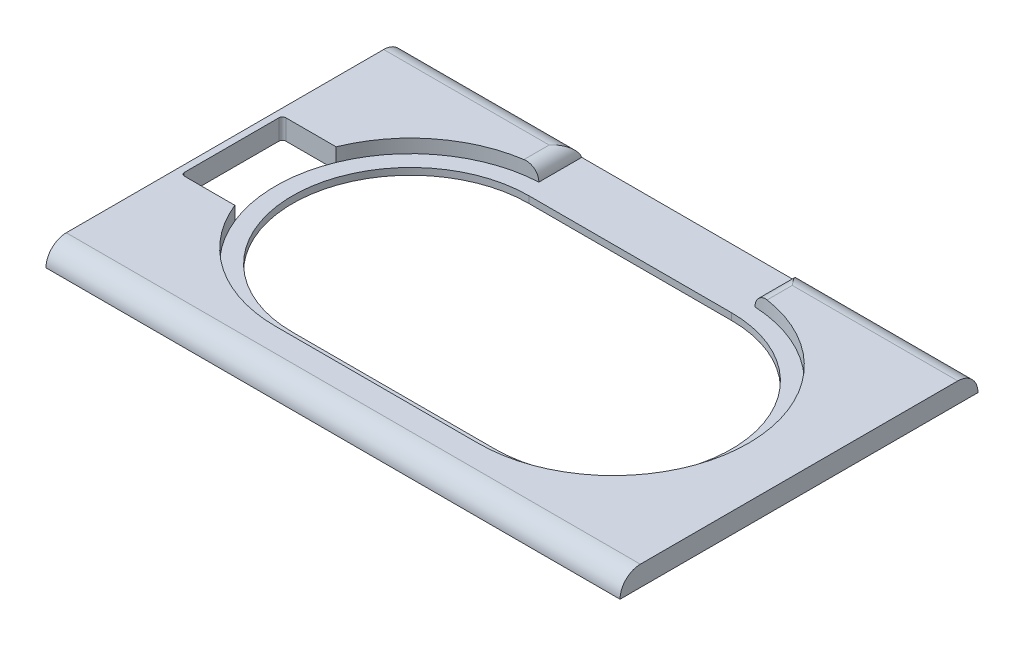
from build123d import *

# Parameters (mm, degrees)
SKETCH1_W           = 170
SKETCH1_H           = 106
BOSS_EXTRUDE1_DEPTH = 6
FILLET1_R           = 6
CUT_EXTRUDE1_DEPTH  = 4
CUT_EXTRUDE2_DEPTH  = 201.429538741
CUT_EXTRUDE3_DEPTH  = 25
CUT_EXTRUDE4_DEPTH  = 201.379639771
FILLET2_R           = 1


with BuildPart() as part:
    # Sketch1 → Boss-Extrude1 (new body)
    with BuildSketch(Plane(origin=(0, 0, 0), x_dir=(1, 0, 0), z_dir=(0, 1, 0))):
        with Locations((85, -53)):
            Rectangle(SKETCH1_W, SKETCH1_H)
    extrude(amount=BOSS_EXTRUDE1_DEPTH)

    # Fillet1
    fillet1_edges = [part.edges().sort_by_distance(p)[0] for p in [
        (85, 6, 106),
        (85, 6, 0),
    ]]
    fillet(fillet1_edges, radius=FILLET1_R - 0.0001)  # a hair under: the kernel refuses the full size

    # Sketch2 → Cut-Extrude1 (cut)
    with BuildSketch(Plane(origin=(0, 6, 0), x_dir=(1, 0, 0), z_dir=(0, 1, 0))):
        with BuildLine():
            Line((55, -13), (115, -13))
            ThreePointArc((115, -13), (155, -53), (115, -93))
            Line((115, -93), (55, -93))
            ThreePointArc((55, -93), (15, -53), (55, -13))
        make_face()
    extrude(amount=-CUT_EXTRUDE1_DEPTH, mode=Mode.SUBTRACT)

    # Sketch3 → Cut-Extrude2 (cut, through all)
    with BuildSketch(Plane(origin=(0, 6, 0), x_dir=(1, 0, 0), z_dir=(0, 1, 0))):
        with BuildLine():
            Line((2, -53), (2, -38))
            Line((2, -38), (17.919007565, -38))
            ThreePointArc((17.919007565, -38), (15, -53), (17.919007565, -68))
            Line((17.919007565, -68), (2, -68))
            Line((2, -68), (2, -53))
        make_face()
    extrude(amount=-CUT_EXTRUDE2_DEPTH, mode=Mode.SUBTRACT)

    # Sketch5 → Cut-Extrude3 (cut)
    with BuildSketch(Plane.XY):
        with BuildLine():
            Line((49, 6), (121, 6))
            ThreePointArc((121, 6), (118.171572875, 4.828427125), (117, 2))
            Line((117, 2), (53, 2))
            ThreePointArc((53, 2), (51.828427125, 4.828427125), (49, 6))
        make_face()
    extrude(amount=CUT_EXTRUDE3_DEPTH, mode=Mode.SUBTRACT)

    # Sketch8 → Cut-Extrude4 (cut, through all)
    with BuildSketch(Plane(origin=(0, 2, 0), x_dir=(1, 0, 0), z_dir=(0, 1, 0))):
        with BuildLine():
            Line((55, -18), (115, -18))
            ThreePointArc((115, -18), (150, -53), (115, -88))
            Line((115, -88), (55, -88))
            ThreePointArc((55, -88), (20, -53), (55, -18))
        make_face()
    extrude(amount=-CUT_EXTRUDE4_DEPTH, mode=Mode.SUBTRACT)

    # Fillet2
    fillet2_edges = [part.edges().sort_by_distance(p)[0] for p in [
        (2, 3, 38),
        (2, 3, 68),
    ]]
    fillet(fillet2_edges, radius=FILLET2_R)


solid = part.part
